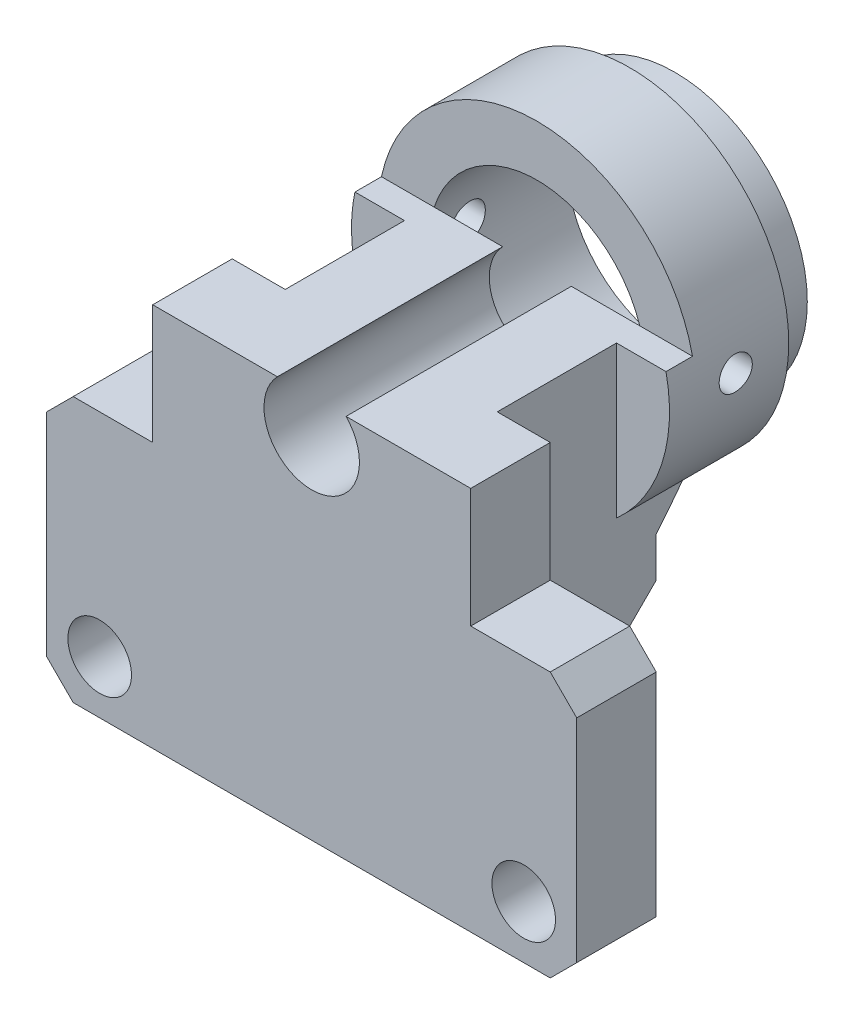
from build123d import *

# Parameters (mm, degrees)
SKETCH1_W                = 20
SKETCH1_H                = 10
BOSS_EXTRUDE1_DEPTH      = 3
SKETCH2_W                = 8
SKETCH2_H                = 9.5
BOSS_EXTRUDE2_DEPTH      = 6
BOSS_EXTRUDE3_DEPTH      = 6
BOSS_EXTRUDE3_DEPTH_BACK = 1.5
SKETCH3_R                = 6
CHAMFER1_SIZE            = 1
CHAMFER2_SIZE            = 1
CHAMFER3_SIZE            = 1
CHAMFER4_SIZE            = 2
CHAMFER5_SIZE            = 2
M2_CLEARANCE_HOLE1_D     = 2.4
SKETCH21_R               = 4.075
CUT_EXTRUDE10_DEPTH      = 6.5
SKETCH25_W               = 12
SKETCH25_H               = 4.5
BOSS_EXTRUDE6_DEPTH      = 3
M1_6_TAPPED_HOLE2_D      = 1.25
CUT_EXTRUDE15_START      = -3
SKETCH40_R               = 6
CUT_EXTRUDE15_DEPTH      = 3
BOSS_EXTRUDE8_START      = 1.7
SKETCH41_R               = 5
SKETCH41_R_2             = 4.075
BOSS_EXTRUDE8_DEPTH      = 1.7
CUT_EXTRUDE16_DEPTH      = 1


with BuildPart() as part:
    # Sketch1 → Boss-Extrude1 (new body)
    with BuildSketch(Plane.XY):
        Rectangle(SKETCH1_W, SKETCH1_H)
    extrude(amount=BOSS_EXTRUDE1_DEPTH)

    # Sketch2 → Boss-Extrude2 (add)
    with BuildSketch(Plane(origin=(0, 0, 0), x_dir=(-1, 0, 0), z_dir=(0, 0, -1))):
        with Locations((0, 4.75)):
            Rectangle(SKETCH2_W, SKETCH2_H)
    extrude(amount=BOSS_EXTRUDE2_DEPTH)

    # Sketch3 → Boss-Extrude3 (add, two sides: drawn at the far end of the back side and taken through both)
    with BuildSketch(Plane(origin=(0, 0, -6), x_dir=(-1, 0, 0), z_dir=(0, 0, -1)).offset(-BOSS_EXTRUDE3_DEPTH_BACK)):
        with Locations((0, 8.25)):
            Circle(SKETCH3_R)
    extrude(amount=BOSS_EXTRUDE3_DEPTH + BOSS_EXTRUDE3_DEPTH_BACK)

    # Chamfer1
    chamfer1_edges = [part.edges().sort_by_distance(p)[0] for p in [
        (-10, 5, 1.5),
        (10, 5, 1.5),
        (10, -5, 1.5),
        (-10, -5, 1.5),
    ]]
    chamfer(chamfer1_edges, length=CHAMFER1_SIZE)

    # Chamfer2
    chamfer2_edges = [part.edges().sort_by_distance(p)[0] for p in [
        (4, 2.5, 0),
        (-4, 2.5, 0),
        (0, 0, 0),
        (0, 0, -6),
    ]]
    chamfer(chamfer2_edges, length=CHAMFER2_SIZE)

    # Chamfer3
    # the kernel refuses this chamfer: 1 mm, written as the material it adds along each edge
    with BuildSketch(Plane(origin=(0, 8.25, -6), x_dir=(0.9161991076005935, -0.4007233400138756, 0), z_dir=(0.4007233400138756, 0.9161991076005935, 0))) as chamfer3_piece_1_section:
        Polygon((6 + CHAMFER3_SIZE, 0), (6, CHAMFER3_SIZE), (6, 0), align=None)
    chamfer3_piece_1 = revolve(axis=Axis((0, 8.25, -6), (0, 0, -1)), revolution_arc=132.753188511, mode=Mode.PRIVATE)
    chamfer3_piece_1 = split(chamfer3_piece_1, bisect_by=Plane(origin=(-4, 1.761901104, -6.488098896), z_dir=(1, 0, 0)), keep=Keep.TOP, mode=Mode.PRIVATE)
    chamfer3_piece_1 = split(chamfer3_piece_1, bisect_by=Plane(origin=(4, 1.761901104, -6.488098896), z_dir=(-1, 0, 0)), keep=Keep.TOP, mode=Mode.PRIVATE)
    add(chamfer3_piece_1)

    # Chamfer4
    chamfer4_edges = [part.edges().sort_by_distance(p)[0] for p in [
        (0, 5, 0),
    ]]
    chamfer(chamfer4_edges, length=CHAMFER4_SIZE)

    # Chamfer5
    # the kernel refuses this chamfer: 2 mm, written as the material it adds along each edge
    with BuildSketch(Plane(origin=(4, 5, -6.143365976), x_dir=(0.9996219169112968, -0.02749587661058651, 0), z_dir=(0, 0, 1))) as chamfer5_piece_1_section:
        Polygon((CHAMFER5_SIZE * 0.999621916911, CHAMFER5_SIZE * 0.0274958766106), (-CHAMFER5_SIZE * 0.0274958766106, CHAMFER5_SIZE * 0.999621916911), (0, 0), align=None)
    chamfer5_piece_1 = extrude(amount=13.286731952, mode=Mode.PRIVATE)
    chamfer5_piece_1 = split(chamfer5_piece_1, bisect_by=Plane(origin=(4.448565439, 5.872663391, -0.551434561), z_dir=(-0.7071067811865476, 0, 0.7071067811865476)), keep=Keep.TOP, mode=Mode.PRIVATE)
    chamfer5_piece_1 = split(chamfer5_piece_1, bisect_by=Plane(origin=(4.264786899, 6.620159706, 0.379840294), z_dir=(0, -0.7071067811865476, -0.7071067811865476)), keep=Keep.TOP, mode=Mode.PRIVATE)
    chamfer5_piece_1 = split(chamfer5_piece_1, bisect_by=Plane(origin=(4.264786899, 5.872663391, 0), z_dir=(0, 0, -1)), keep=Keep.TOP, mode=Mode.PRIVATE)
    add(chamfer5_piece_1)
    with BuildSketch(Plane(origin=(4, 5, -6.143365976), x_dir=(0.9996219169112968, -0.02749587661058651, 0), z_dir=(0, 0, 1))) as chamfer5_piece_2_section:
        Polygon((CHAMFER5_SIZE * 0.999621916911, CHAMFER5_SIZE * 0.0274958766106), (-CHAMFER5_SIZE * 0.0274958766106, CHAMFER5_SIZE * 0.999621916911), (0, 0), align=None)
    chamfer5_piece_2 = extrude(amount=13.286731952, mode=Mode.PRIVATE)
    chamfer5_piece_2 = split(chamfer5_piece_2, bisect_by=Plane(origin=(5.409489173, 5.195513982, 0.409489173), z_dir=(0.7071067811865476, 0, -0.7071067811865476)), keep=Keep.TOP, mode=Mode.PRIVATE)
    chamfer5_piece_2 = split(chamfer5_piece_2, bisect_by=Plane(origin=(5.545985564, 5.195513982, 0), z_dir=(0, 0, 1)), keep=Keep.TOP, mode=Mode.PRIVATE)
    add(chamfer5_piece_2)
    with BuildSketch(Plane(origin=(4, 5, -6.143365976), x_dir=(0.9996219169112968, -0.02749587661058651, 0), z_dir=(0, 0, 1))) as chamfer5_piece_3_section:
        Polygon((CHAMFER5_SIZE * 0.999621916911, CHAMFER5_SIZE * 0.0274958766106), (-CHAMFER5_SIZE * 0.0274958766106, CHAMFER5_SIZE * 0.999621916911), (0, 0), align=None)
    chamfer5_piece_3 = extrude(amount=13.286731952, mode=Mode.PRIVATE)
    chamfer5_piece_3 = split(chamfer5_piece_3, bisect_by=Plane(origin=(5.251928591, 5.490690976, 0.251928591), z_dir=(-0.7071067811865476, 0, 0.7071067811865476)), keep=Keep.TOP, mode=Mode.PRIVATE)
    chamfer5_piece_3 = split(chamfer5_piece_3, bisect_by=Plane(origin=(4.702100532, 5.844467162, 1.155532838), z_dir=(0, -0.7071067811865476, -0.7071067811865476)), keep=Keep.TOP, mode=Mode.PRIVATE)
    chamfer5_piece_3 = split(chamfer5_piece_3, bisect_by=Plane(origin=(4.702100532, 5.490690976, 0), z_dir=(0, 0, 1)), keep=Keep.TOP, mode=Mode.PRIVATE)
    add(chamfer5_piece_3)
    with BuildSketch(Plane(origin=(-4, 5, 7.143365976), x_dir=(-0.9996219169112968, -0.027495876610586487, 0), z_dir=(0, 0, -1))) as chamfer5_piece_4_section:
        Polygon((CHAMFER5_SIZE * 0.999621916911, CHAMFER5_SIZE * 0.0274958766106), (-CHAMFER5_SIZE * 0.0274958766106, CHAMFER5_SIZE * 0.999621916911), (0, 0), align=None)
    chamfer5_piece_4 = extrude(amount=13.286731952, mode=Mode.PRIVATE)
    chamfer5_piece_4 = split(chamfer5_piece_4, bisect_by=Plane(origin=(-5.251928591, 5.490690976, 0.251928591), z_dir=(0.7071067811865476, 0, 0.7071067811865476)), keep=Keep.TOP, mode=Mode.PRIVATE)
    chamfer5_piece_4 = split(chamfer5_piece_4, bisect_by=Plane(origin=(-4.702100532, 5.844467162, 1.155532838), z_dir=(0, -0.7071067811865476, -0.7071067811865476)), keep=Keep.TOP, mode=Mode.PRIVATE)
    chamfer5_piece_4 = split(chamfer5_piece_4, bisect_by=Plane(origin=(-4.702100532, 5.490690976, 0), z_dir=(0, 0, 1)), keep=Keep.TOP, mode=Mode.PRIVATE)
    add(chamfer5_piece_4)
    with BuildSketch(Plane(origin=(-4, 5, 7.143365976), x_dir=(-0.9996219169112968, -0.027495876610586487, 0), z_dir=(0, 0, -1))) as chamfer5_piece_5_section:
        Polygon((CHAMFER5_SIZE * 0.999621916911, CHAMFER5_SIZE * 0.0274958766106), (-CHAMFER5_SIZE * 0.0274958766106, CHAMFER5_SIZE * 0.999621916911), (0, 0), align=None)
    chamfer5_piece_5 = extrude(amount=13.286731952, mode=Mode.PRIVATE)
    chamfer5_piece_5 = split(chamfer5_piece_5, bisect_by=Plane(origin=(-4.448565439, 5.872663391, -0.551434561), z_dir=(0.7071067811865476, 0, 0.7071067811865476)), keep=Keep.TOP, mode=Mode.PRIVATE)
    chamfer5_piece_5 = split(chamfer5_piece_5, bisect_by=Plane(origin=(-4.264786899, 6.620159706, 0.379840294), z_dir=(0, -0.7071067811865476, -0.7071067811865476)), keep=Keep.TOP, mode=Mode.PRIVATE)
    chamfer5_piece_5 = split(chamfer5_piece_5, bisect_by=Plane(origin=(-4.264786899, 5.872663391, 0), z_dir=(0, 0, -1)), keep=Keep.TOP, mode=Mode.PRIVATE)
    add(chamfer5_piece_5)
    with BuildSketch(Plane(origin=(-4, 5, 7.143365976), x_dir=(-0.9996219169112968, -0.027495876610586487, 0), z_dir=(0, 0, -1))) as chamfer5_piece_6_section:
        Polygon((CHAMFER5_SIZE * 0.999621916911, CHAMFER5_SIZE * 0.0274958766106), (-CHAMFER5_SIZE * 0.0274958766106, CHAMFER5_SIZE * 0.999621916911), (0, 0), align=None)
    chamfer5_piece_6 = extrude(amount=13.286731952, mode=Mode.PRIVATE)
    chamfer5_piece_6 = split(chamfer5_piece_6, bisect_by=Plane(origin=(-5.409489173, 5.195513982, 0.409489173), z_dir=(-0.7071067811865476, 0, -0.7071067811865476)), keep=Keep.TOP, mode=Mode.PRIVATE)
    chamfer5_piece_6 = split(chamfer5_piece_6, bisect_by=Plane(origin=(-5.545985564, 5.195513982, 0), z_dir=(0, 0, 1)), keep=Keep.TOP, mode=Mode.PRIVATE)
    add(chamfer5_piece_6)

    # M2 Clearance Hole1 (through all)
    with Locations(Plane(origin=(0, 0, 0), x_dir=(-1, 0, 0), z_dir=(0, 0, -1))):
        with Locations((8, -3), (-8, -3)):
            Hole(M2_CLEARANCE_HOLE1_D / 2)

    # Sketch21 → Cut-Extrude10 (cut)
    with BuildSketch(Plane(origin=(0, 0, -12), x_dir=(-1, 0, 0), z_dir=(0, 0, -1))):
        with Locations((0, 8.25)):
            Circle(SKETCH21_R)
    extrude(amount=-CUT_EXTRUDE10_DEPTH, mode=Mode.SUBTRACT)

    # Sketch25 → Boss-Extrude6 (add)
    with BuildSketch(Plane.XY):
        with Locations((0, 7.25)):
            Rectangle(SKETCH25_W, SKETCH25_H)
    extrude(amount=BOSS_EXTRUDE6_DEPTH)

    # Sketch24 → CSK SLOT for M1.6 Countersunk Flat Head (revolve, cut)
    with BuildSketch(Plane(origin=(0, 8.25, 3), x_dir=(0, -1, 0), z_dir=(1, 0, 0))):
        Polygon((0, 0), (0, 40.540774557), (0.9, 40), (0.9, 9.9), (1.8, 9), (1.8, 0), align=None)
    revolve(axis=Axis((0, 8.25, 9.35), (0, 0, -1)), mode=Mode.SUBTRACT)

    # M1.6 Tapped Hole2 (through all)
    with Locations(Plane.ZY.offset(6)):
        with Locations((-7, 8.25)):
            Hole(M1_6_TAPPED_HOLE2_D / 2)

    # Sketch40 → Cut-Extrude15 (cut)
    with BuildSketch(Plane(origin=(0, 0, -12), x_dir=(-1, 0, 0), z_dir=(0, 0, -1)).offset(CUT_EXTRUDE15_START)):
        with Locations((0, 8.25)):
            Circle(SKETCH40_R)
    extrude(amount=CUT_EXTRUDE15_DEPTH, mode=Mode.SUBTRACT)

    # Sketch41 → Boss-Extrude8 (add)
    with BuildSketch(Plane(origin=(0, 0, -9), x_dir=(-1, 0, 0), z_dir=(0, 0, -1)).offset(BOSS_EXTRUDE8_START)):
        with Locations((0, 8.25)):
            Circle(SKETCH41_R)
        with Locations((0, 8.25)):
            Circle(SKETCH41_R_2, mode=Mode.SUBTRACT)
    extrude(amount=-BOSS_EXTRUDE8_DEPTH)

    # Sketch43 → Cut-Extrude16 (cut)
    with BuildSketch(Plane.XY.offset(-4.5)):
        with BuildLine():
            Line((-4, 9.5), (-1.295183385, 9.5))
            ThreePointArc((-1.295183385, 9.5), (0, 10.05), (1.295183385, 9.5))
            Line((1.295183385, 9.5), (4, 9.5))
            Line((4, 9.5), (5.868347297, 9.5))
            ThreePointArc((5.868347297, 9.5), (0, 14.25), (-5.868347297, 9.5))
            Line((-5.868347297, 9.5), (-4, 9.5))
        make_face()
    extrude(amount=-CUT_EXTRUDE16_DEPTH, mode=Mode.SUBTRACT)


solid = part.part
